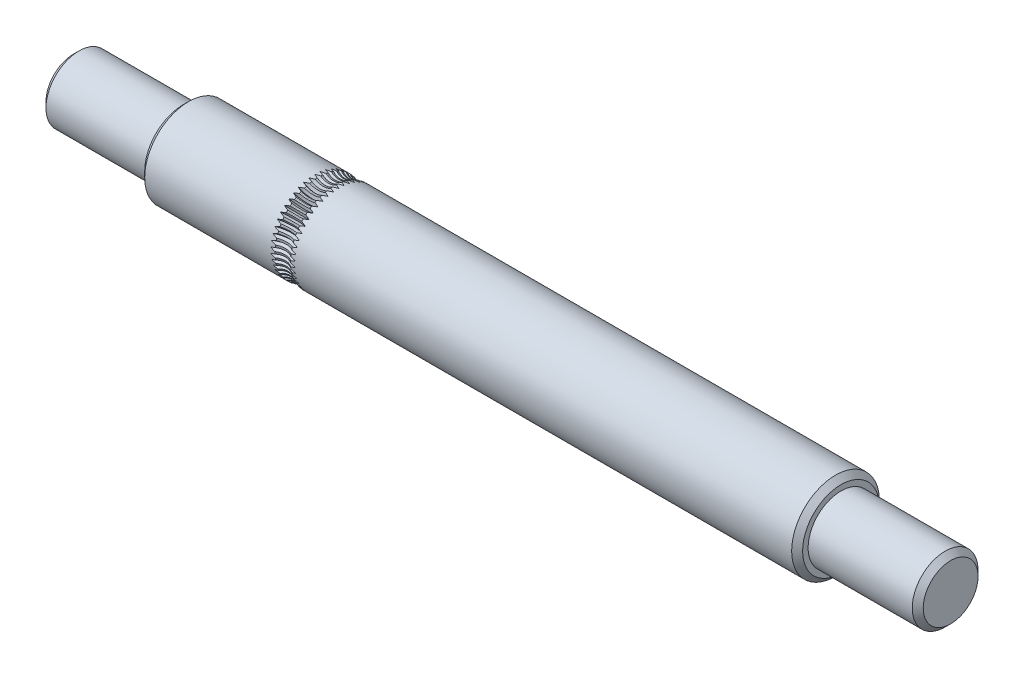
from build123d import *

# Parameters (mm, degrees)
CHAMFER1_SIZE     = 0.5
CIRPATTERN1_COUNT = 50


with BuildPart() as part:
    # Sketch1 → Revolve1 (revolve)
    with BuildSketch(Plane.XY):
        Polygon((-13.1, 4), (46.9, 4), (46.9, 3), (56.9, 3), (56.9, 0), (-23.1, 0), (-23.1, 3), (-13.1, 3), align=None)
    revolve(axis=Axis((0, 0, 0), (1, 0, 0)))

    # Chamfer1
    chamfer1_edges = [part.edges().sort_by_distance(p)[0] for p in [
        (56.9, -3, 0),
        (46.9, -4, 0),
        (-13.1, -4, 0),
        (-23.1, -3, 0),
    ]]
    chamfer(chamfer1_edges, length=CHAMFER1_SIZE)

    # Sketch2 → Cut-Revolve1 (revolve, cut)
    with BuildSketch(Plane(origin=(0, 0, 0), x_dir=(0, 0, -1), z_dir=(1, 0, 0))):
        Polygon((0.156173248, 3.7705), (0, 3.5), (-0.156173248, 3.7705), (-1.3354137, 3.7705), (-1.3354137, 5), (1.3354137, 5), (1.3354137, 3.7705), align=None)
    cut_revolve1 = revolve(axis=Axis((0, 5, -9.989903303), (0, 0, 1)), mode=Mode.SUBTRACT)

    # CirPattern1: Cut-Revolve1 ×50 about axis
    cirpattern1_axis = Axis((0, 0, 0), (-1, 0, 0))
    for i in range(1, CIRPATTERN1_COUNT):
        add(cut_revolve1.rotate(cirpattern1_axis, i * 360 / CIRPATTERN1_COUNT), mode=Mode.SUBTRACT)


solid = part.part
